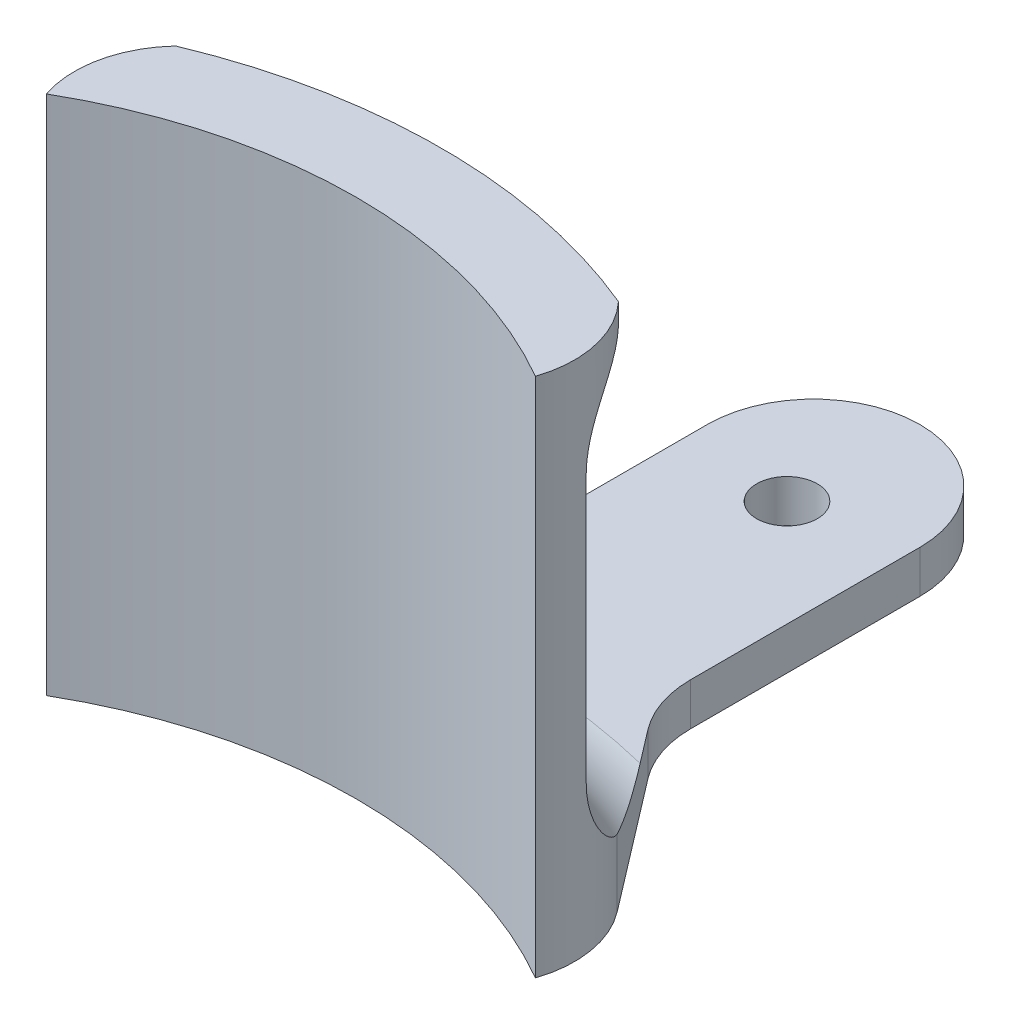
from build123d import *

# Parameters (mm, degrees)
EXTRUDE_1_DEPTH     = 4
SKETCH_2_R          = 2.85
CUT_EXTRUDE_1_DEPTH = 10.000000000000002
EXTRUDE_2_DEPTH     = 45
FILLET_1_R          = 10
EXTRUDE_START       = -2
EXTRUDE_3_DEPTH     = 2
FILLET_2_R          = 10
FILLET_3_DEPTH      = 50
FILLET_START        = 44.37538
FILLET_3_2_DEPTH    = 5.62462
FILLET_3_3_DEPTH    = 4


with BuildPart() as part:
    # 草图1 → 凸台-拉伸1 (new body)
    with BuildSketch(Plane(origin=(0, 0, 0), x_dir=(1, 0, 0), z_dir=(0, 1, 0))):
        with BuildLine():
            ThreePointArc((-10, -25), (5.66e-15, -23.98979485566356), (10.000000000000009, -25))
            Line((10.000000000000002, -25.000000000000007), (9.999999999999996, 24.999999999999993))
            Line((9.999999999999996, 24.999999999999993), (-10.000000000000004, 24.999999999999993))
            Line((-10.000000000000004, 24.999999999999993), (-9.999999999999996, -25.000000000000007))
        make_face()
        with BuildLine():
            ThreePointArc((-23.00000000000064, -34.15262628157976), (5.42e-15, -27.98979485566356), (23.000000000000654, -34.15262628157976))
            Line((23.000000000000064, -34.15262628157941), (25.00000000000006, -30.688524666441673))
            ThreePointArc((25.000000000000064, -30.688524666441666), (17.729631361654985, -27.23875024936818), (10.000000000000009, -25))
            Line((10.000000000000004, -25.000000000000007), (-9.999999999999996, -25.000000000000007))
            ThreePointArc((-10, -25), (-17.72963136165498, -27.23875024936818), (-25.000000000000064, -30.688524666441673))
            Line((-25.00000000000006, -30.688524666441673), (-23.000000000000057, -34.152626281579415))
        make_face()
        with BuildLine():
            Line((-9.999999999999996, -25.000000000000007), (10.000000000000004, -25.000000000000007))
            ThreePointArc((10.000000000000009, -25), (5.66e-15, -23.98979485566356), (-10, -25))
        make_face()
    extrude(amount=EXTRUDE_1_DEPTH)

    # 草图2 → 切除-拉伸1 (cut)
    with BuildSketch(Plane(origin=(0, 4, 0), x_dir=(1, 0, 0), z_dir=(0, 1, 0))):
        with Locations(Location((-1.73e-15, 12.499999999999996, 0), (0, 0, 270))):
            Circle(SKETCH_2_R)
    extrude(amount=-CUT_EXTRUDE_1_DEPTH, mode=Mode.SUBTRACT)

    # 草图3 → 凸台-拉伸2 (add)
    with BuildSketch(Plane(origin=(0, 4, 0), x_dir=(1, 0, 0), z_dir=(0, 1, 0))):
        with BuildLine():
            ThreePointArc((9.999999999999995, -25.000000000000007), (5.66e-15, -23.989794855663575), (-9.999999999999996, -25.000000000000014))
            ThreePointArc((-9.999999999999996, -25.000000000000014), (-17.729631361654977, -27.238750249368195), (-25.000000000000057, -30.68852466644168))
            Line((-25.000000000000064, -30.68852466644167), (-23.00000000000006, -34.152626281579415))
            ThreePointArc((-23.000000000000064, -34.152626281579415), (-5.33e-15, -27.98979485566356), (23.000000000000064, -34.15262628157941))
            Line((23.000000000000057, -34.152626281579415), (25.00000000000006, -30.688524666441673))
            ThreePointArc((25.000000000000057, -30.68852466644168), (17.72963136165498, -27.238750249368195), (9.999999999999995, -25.000000000000007))
        make_face()
    extrude(amount=EXTRUDE_2_DEPTH)

    # 倒角1
    # the kernel refuses this chamfer: 25.647736894, 20 mm, written as the material it adds along each edge
    with BuildSketch(Plane(origin=(10.000000000000004, 0, 25.00000000000001), x_dir=(-2.4e-16, 0, -1), z_dir=(0, 1, 0))) as chamfer_1_piece_1_section:
        with BuildLine():
            Line((15.870240384772439, 0.6233017511174166), (-7.473452483423025, -17.23288480714665))
            Line((-7.473452483423025, -17.23288480714665), (-7.907732226484158, -16.959894573117097))
            ThreePointArc((-7.907732226484158, -16.959894573117097), (-3.2240953608677487, -8.827331157857245), (-0.5025909475750687, 0.10259094757506672))
            Line((-0.5025909475750687, 0.10259094757506672), (1.2e-16, 0.5129547378753365))
            ThreePointArc((1.2e-16, 0.5129547378753365), (7.9351201923862185, 0.5129547378753364), (15.870240384772439, 1.136256488992753))
            Line((15.870240384772439, 1.136256488992753), (15.870240384772439, 0.6233017511174166))
        make_face()
    chamfer_1_piece_1 = extrude(amount=4, mode=Mode.PRIVATE)
    chamfer_1_piece_1 = split(chamfer_1_piece_1, bisect_by=Plane(origin=(23.713203435596473, 0, 32.91732169499376), z_dir=(-0.8660254037844379, 0, -0.5000000000000014)), keep=Keep.TOP, mode=Mode.PRIVATE)
    add(chamfer_1_piece_1)
    with BuildSketch(Plane(origin=(-9.999999999999996, 0, 25.000000000000007), x_dir=(-1.2e-16, 0, -1), z_dir=(0, 1, 0))) as chamfer_1_piece_2_section:
        with BuildLine():
            Line((15.8702403847722, -0.6233017511174258), (-7.473452483423406, 17.232884807146757))
            Line((-7.473452483423406, 17.232884807146757), (-7.907732226484546, 16.959894573117197))
            ThreePointArc((-7.907732226484546, 16.959894573117197), (-3.224095360867959, 8.827331157857294), (-0.5025909475750723, -0.10259094757507187))
            Line((-0.5025909475750723, -0.10259094757507187), (-6e-17, -0.5129547378753436))
            ThreePointArc((-6e-17, -0.5129547378753436), (7.935120192386101, -0.5129547378753427), (15.8702403847722, -1.1362564889927693))
            Line((15.8702403847722, -1.1362564889927693), (15.8702403847722, -0.6233017511174258))
        make_face()
    chamfer_1_piece_2 = extrude(amount=4, mode=Mode.PRIVATE)
    chamfer_1_piece_2 = split(chamfer_1_piece_2, bisect_by=Plane(origin=(-23.713203435596462, 0, 32.917321694993774), z_dir=(0.8660254037844375, 0, -0.500000000000002)), keep=Keep.TOP, mode=Mode.PRIVATE)
    add(chamfer_1_piece_2)

    # 圆角1
    fillet_1_edges = [part.edges().sort_by_distance(p)[0] for p in [
        (3.375e-14, 4, 23.989794855663604),
    ]]
    fillet(fillet_1_edges, radius=FILLET_1_R)

    # 草图4 → 凸台-拉伸3 (add)
    with BuildSketch(Plane(origin=(0, 49, 0), x_dir=(1, 0, 0), z_dir=(0, 1, 0)).offset(EXTRUDE_START)):
        with BuildLine():
            Line((-27.00000000000007, -27.22442305130391), (-25.00000000000007, -30.68852466644167))
            ThreePointArc((-25.00000000000007, -30.68852466644167), (5.66e-15, -23.98979485566357), (25.00000000000006, -30.688524666441673))
            Line((25.00000000000006, -30.688524666441673), (27.00000000000007, -27.22442305130391))
            ThreePointArc((27.00000000000007, -27.22442305130391), (5.91e-15, -19.989794855663554), (-27.00000000000007, -27.22442305130391))
        make_face()
    extrude(amount=EXTRUDE_3_DEPTH)

    # 圆角2
    # the kernel refuses this fillet: 10 mm, written as the material it adds along each edge
    with BuildSketch(Plane(origin=(-7.11e-15, 47, 73.9897948556636), x_dir=(-0.5000000000000009, 0, -0.8660254037844382), z_dir=(-0.8660254037844382, 0, 0.5000000000000009))) as fillet_2_piece_1:
        with BuildLine():
            CenterArc((60.000000000000014, 8.000000000000028), FILLET_2_R, 180, 53.13010235415629)
            Line((50.00000000000002, 8.000000000000028), (49.80000000000001, 8.000000000000028))
            Line((49.80000000000001, 8.000000000000028), (49.80000000000004, 0))
            Line((49.80000000000004, 0), (50.000000000000036, -0.20000000000000284))
            ThreePointArc((50.000000000000036, -0.20000000000000284), (52.000000000000036, -0.20000000000000284), (53.88000000000005, -0.1600000000000037))
            Line((53.88000000000005, -0.1600000000000037), (54.00000000000006, 0))
        make_face()
    revolve(axis=Axis((-7.11e-15, 47, 73.9897948556636), (0, -1, 0)), revolution_arc=60.000000000000135)

    # 圆角3: read off the stored shape, not the designer's step
    # 圆角3 outline → 圆角3 (cut)
    with BuildSketch(Plane(origin=(0, 0, 0), x_dir=(1, 0, 0), z_dir=(0, 1, 0))):
        with BuildLine():
            ThreePointArc((-23, -34.152626282), (-23.374473484, -29.343864194), (-21.454427524, -24.919178135))
            Line((-21.454427524, -24.919178135), (-20.904466424, -24.200204744))
            ThreePointArc((-20.904466424, -24.200204744), (-23.999915623, -25.616206503), (-27, -27.224423051))
            Line((-27, -27.224423051), (-23, -34.152626282))
        make_face()
        with BuildLine():
            Line((23, -34.152626282), (27, -27.224423051))
            ThreePointArc((27, -27.224423051), (23.999915623, -25.616206503), (20.904466424, -24.200204744))
            Line((20.904466424, -24.200204744), (21.454427366, -24.919177929))
            ThreePointArc((21.454427366, -24.919177929), (23.374473462, -29.343864066), (23, -34.152626282))
        make_face()
        with BuildLine():
            Line((-10, 25), (-10, 15))
            ThreePointArc((-10, 15), (-7.071067812, 22.071067812), (0, 25))
            Line((0, 25), (-10, 25))
        make_face()
        with BuildLine():
            Line((10, 25), (0, 25))
            ThreePointArc((0, 25), (7.071067812, 22.071067812), (10, 15))
            Line((10, 15), (10, 25))
        make_face()
    extrude(amount=FILLET_3_DEPTH, mode=Mode.SUBTRACT)

    # Fillet 3 2 outline → Fillet 3 2 (cut)
    with BuildSketch(Plane(origin=(0, 0, 0), x_dir=(1, 0, 0), z_dir=(0, 1, 0)).offset(FILLET_START)):
        with BuildLine():
            Line((-20.904466424, -24.200204744), (-21.454427524, -24.919178135))
            ThreePointArc((-21.454427524, -24.919178135), (-21.143258439, -24.532645684), (-20.813297877, -24.162025174))
            ThreePointArc((-20.813297877, -24.162025174), (-20.858890886, -24.1810941), (-20.904466424, -24.200204744))
        make_face()
        with BuildLine():
            ThreePointArc((20.904466424, -24.200204744), (20.858890886, -24.1810941), (20.813297877, -24.162025174))
            ThreePointArc((20.813297877, -24.162025174), (21.143258356, -24.532645585), (21.454427366, -24.919177929))
            Line((21.454427366, -24.919177929), (20.904466424, -24.200204744))
        make_face()
    extrude(amount=FILLET_3_2_DEPTH, mode=Mode.SUBTRACT)

    # Fillet 3 3 outline → Fillet 3 3 (add)
    with BuildSketch(Plane(origin=(0, 0, 0), x_dir=(1, 0, 0), z_dir=(0, 1, 0))):
        with BuildLine():
            ThreePointArc((-10, -6.558505859), (-10.528269314, -9.765734851), (-12.057263561, -12.634107711))
            Line((-12.057263561, -12.634107711), (-10, -9.944612473))
            Line((-10, -9.944612473), (-10, -6.558505859))
        make_face()
        with BuildLine():
            Line((10, -9.944612473), (12.057263561, -12.634107711))
            ThreePointArc((12.057263561, -12.634107711), (10.528269314, -9.765734851), (10, -6.558505859))
            Line((10, -6.558505859), (10, -9.944612473))
        make_face()
    extrude(amount=FILLET_3_3_DEPTH)


solid = part.part
